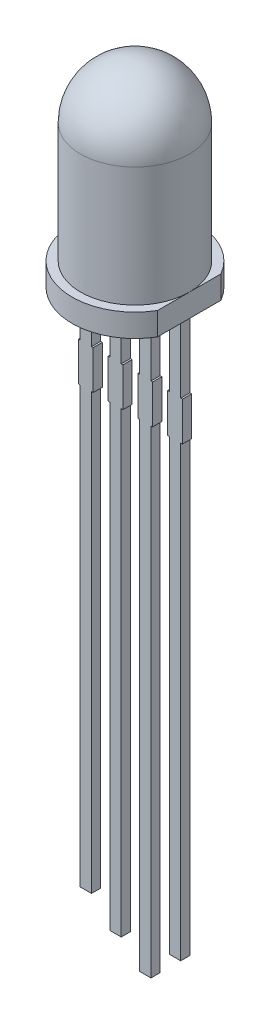
from build123d import *

# Parameters (mm, degrees)
BOSS_EXTRUDE1_START         = -4
BOSS_EXTRUDE1_OUTLINE_W     = 0.5
BOSS_EXTRUDE1_OUTLINE_H     = 0.4
BOSS_EXTRUDE1_OUTLINE_W_2   = 1.8
BOSS_EXTRUDE1_DEPTH         = 25.3
BOSS_EXTRUDE1_2_OUTLINE_W   = 0.5
BOSS_EXTRUDE1_2_OUTLINE_H   = 0.4
BOSS_EXTRUDE1_2_OUTLINE_W_2 = 1.8
BOSS_EXTRUDE1_2_DEPTH       = 1
BOSS_EXTRUDE1_3_OUTLINE_W   = 0.075
BOSS_EXTRUDE1_3_OUTLINE_H   = 0.4
BOSS_EXTRUDE1_3_DEPTH       = 21.3
BOSS_EXTRUDE1_START_2       = 21.3
BOSS_EXTRUDE1_4_OUTLINE_W   = 0.65
BOSS_EXTRUDE1_4_OUTLINE_H   = 0.4
BOSS_EXTRUDE1_4_OUTLINE_W_2 = 1.875
BOSS_EXTRUDE1_4_DEPTH       = 0.4
BOSS_EXTRUDE1_START_3       = 21.7
BOSS_EXTRUDE1_5_OUTLINE_W   = 0.65
BOSS_EXTRUDE1_5_OUTLINE_H   = 0.4
BOSS_EXTRUDE1_5_DEPTH       = 0.9
SKETCH2_W                   = 1.225
SKETCH2_H                   = 21.7
CUT_EXTRUDE1_DEPTH          = 26.915728815
SKETCH6_W                   = 0.4
SKETCH6_H                   = 3
CUT_EXTRUDE2_DEPTH          = 0.8
SKETCH11_W                  = 0.65
SKETCH11_H                  = 0.4
BOSS_EXTRUDE2_DEPTH         = 20.7
SKETCH17_W                  = 0.075
SKETCH17_H                  = 20
CUT_EXTRUDE3_DEPTH          = 0.4
SKETCH18_W                  = 0.075
SKETCH18_H                  = 20
CUT_EXTRUDE4_DEPTH          = 26.915728815
SKETCH19_W                  = 0.075
SKETCH19_H                  = 19.6
CUT_EXTRUDE5_DEPTH          = 26.915728815
SKETCH20_W                  = 0.075
SKETCH20_H                  = 19.6
CUT_EXTRUDE6_DEPTH          = 26.915728815
SKETCH21_W                  = 0.075
SKETCH21_H                  = 20.9
CUT_EXTRUDE7_DEPTH          = 0.4
SKETCH22_W                  = 0.075
SKETCH22_H                  = 20.9
CUT_EXTRUDE8_DEPTH          = 26.915728815
SKETCH23_W                  = 0.075
SKETCH23_H                  = 19
CUT_EXTRUDE9_DEPTH          = 26.915728815
SKETCH24_W                  = 0.075
SKETCH24_H                  = 19
CUT_EXTRUDE10_DEPTH         = 26.915728815


with BuildPart() as part:
    # Boss-Extrude1: read off the stored shape, not the designer's step
    # Boss-Extrude1 outline → Boss-Extrude1 (new body)
    with BuildSketch(Plane.XZ.offset(3).offset(BOSS_EXTRUDE1_START)):
        with Locations((0.65, 0)):
            Rectangle(BOSS_EXTRUDE1_OUTLINE_W, BOSS_EXTRUDE1_OUTLINE_H)
        with Locations((-1.3, 0)):
            Rectangle(BOSS_EXTRUDE1_OUTLINE_W_2, BOSS_EXTRUDE1_OUTLINE_H)
        with Locations((1.95, 0)):
            Rectangle(BOSS_EXTRUDE1_OUTLINE_W, BOSS_EXTRUDE1_OUTLINE_H)
    extrude(amount=BOSS_EXTRUDE1_DEPTH)

    # Boss-Extrude1 2 outline → Boss-Extrude1 2 (add)
    with BuildSketch(Plane.XZ.offset(3).offset(BOSS_EXTRUDE1_START)):
        with BuildLine():
            ThreePointArc((2.375, 1.386317063), (-2.75, 0), (2.375, -1.386317063))
            Line((2.375, -1.386317063), (2.375, 1.386317063))
        make_face()
        with Locations((0.65, 0)):
            Rectangle(BOSS_EXTRUDE1_2_OUTLINE_W, BOSS_EXTRUDE1_2_OUTLINE_H, mode=Mode.SUBTRACT)
        with Locations((-1.3, 0)):
            Rectangle(BOSS_EXTRUDE1_2_OUTLINE_W_2, BOSS_EXTRUDE1_2_OUTLINE_H, mode=Mode.SUBTRACT)
        with Locations((1.95, 0)):
            Rectangle(BOSS_EXTRUDE1_2_OUTLINE_W, BOSS_EXTRUDE1_2_OUTLINE_H, mode=Mode.SUBTRACT)
    extrude(amount=BOSS_EXTRUDE1_2_DEPTH)

    # Boss-Extrude1 3 outline → Boss-Extrude1 3 (add)
    with BuildSketch(Plane.XZ.offset(3)):
        with Locations((0.3625, 0)):
            Rectangle(BOSS_EXTRUDE1_3_OUTLINE_W, BOSS_EXTRUDE1_3_OUTLINE_H)
        with Locations((0.9375, 0)):
            Rectangle(BOSS_EXTRUDE1_3_OUTLINE_W, BOSS_EXTRUDE1_3_OUTLINE_H)
        with Locations((-0.3625, 0)):
            Rectangle(BOSS_EXTRUDE1_3_OUTLINE_W, BOSS_EXTRUDE1_3_OUTLINE_H)
        with Locations((1.6625, 0)):
            Rectangle(BOSS_EXTRUDE1_3_OUTLINE_W, BOSS_EXTRUDE1_3_OUTLINE_H)
        with Locations((2.2375, 0)):
            Rectangle(BOSS_EXTRUDE1_3_OUTLINE_W, BOSS_EXTRUDE1_3_OUTLINE_H)
    extrude(amount=BOSS_EXTRUDE1_3_DEPTH)

    # Boss-Extrude1 4 outline → Boss-Extrude1 4 (add)
    with BuildSketch(Plane.XZ.offset(3).offset(BOSS_EXTRUDE1_START_2)):
        with Locations((0.65, 0)):
            Rectangle(BOSS_EXTRUDE1_4_OUTLINE_W, BOSS_EXTRUDE1_4_OUTLINE_H)
        with Locations((-1.2625, 0)):
            Rectangle(BOSS_EXTRUDE1_4_OUTLINE_W_2, BOSS_EXTRUDE1_4_OUTLINE_H)
    extrude(amount=BOSS_EXTRUDE1_4_DEPTH)

    # Boss-Extrude1 5 outline → Boss-Extrude1 5 (add)
    with BuildSketch(Plane.XZ.offset(3).offset(BOSS_EXTRUDE1_START_3)):
        with Locations((0.65, 0)):
            Rectangle(BOSS_EXTRUDE1_5_OUTLINE_W, BOSS_EXTRUDE1_5_OUTLINE_H)
    extrude(amount=BOSS_EXTRUDE1_5_DEPTH)

    # Sketch2 → Cut-Extrude1 (cut, through all)
    with BuildSketch(Plane.XY.offset(0.2)):
        with Locations((-1.5875, -13.85)):
            Rectangle(SKETCH2_W, SKETCH2_H)
    extrude(amount=-CUT_EXTRUDE1_DEPTH, mode=Mode.SUBTRACT)

    # Sketch6 → Cut-Extrude2 (cut)
    with BuildSketch(Plane(origin=(-0.9, 0, 0), x_dir=(0, 0, -1), z_dir=(1, 0, 0))):
        with Locations((0, -1.5)):
            Rectangle(SKETCH6_W, SKETCH6_H)
    extrude(amount=-CUT_EXTRUDE2_DEPTH, mode=Mode.SUBTRACT)

    # Sketch11 → Boss-Extrude2 (add)
    with BuildSketch(Plane(origin=(0, -3, 0), x_dir=(-1, 0, 0), z_dir=(0, -1, 0))):
        with Locations((1.95, 0)):
            Rectangle(SKETCH11_W, SKETCH11_H)
    extrude(amount=BOSS_EXTRUDE2_DEPTH)

    # Sketch17 → Cut-Extrude3 (cut)
    with BuildSketch(Plane.XY.offset(0.2)):
        with Locations((-0.3625, -14.7)):
            Rectangle(SKETCH17_W, SKETCH17_H)
    extrude(amount=-CUT_EXTRUDE3_DEPTH, mode=Mode.SUBTRACT)

    # Sketch18 → Cut-Extrude4 (cut, through all)
    with BuildSketch(Plane.XY.offset(0.2)):
        with Locations((-0.9375, -14.7)):
            Rectangle(SKETCH18_W, SKETCH18_H)
    extrude(amount=-CUT_EXTRUDE4_DEPTH, mode=Mode.SUBTRACT)

    # Sketch19 → Cut-Extrude5 (cut, through all)
    with BuildSketch(Plane.XY.offset(0.2)):
        with Locations((2.2375, -14.5)):
            Rectangle(SKETCH19_W, SKETCH19_H)
    extrude(amount=-CUT_EXTRUDE5_DEPTH, mode=Mode.SUBTRACT)

    # Sketch20 → Cut-Extrude6 (cut, through all)
    with BuildSketch(Plane.XY.offset(0.2)):
        with Locations((1.6625, -14.5)):
            Rectangle(SKETCH20_W, SKETCH20_H)
    extrude(amount=-CUT_EXTRUDE6_DEPTH, mode=Mode.SUBTRACT)

    # Sketch21 → Cut-Extrude7 (cut)
    with BuildSketch(Plane.XY.offset(0.2)):
        with Locations((0.9375, -15.15)):
            Rectangle(SKETCH21_W, SKETCH21_H)
    extrude(amount=-CUT_EXTRUDE7_DEPTH, mode=Mode.SUBTRACT)

    # Sketch22 → Cut-Extrude8 (cut, through all)
    with BuildSketch(Plane.XY.offset(0.2)):
        with Locations((0.3625, -15.15)):
            Rectangle(SKETCH22_W, SKETCH22_H)
    extrude(amount=-CUT_EXTRUDE8_DEPTH, mode=Mode.SUBTRACT)

    # Sketch23 → Cut-Extrude9 (cut, through all)
    with BuildSketch(Plane.XY.offset(0.2)):
        with Locations((-1.6625, -14.2)):
            Rectangle(SKETCH23_W, SKETCH23_H)
    extrude(amount=-CUT_EXTRUDE9_DEPTH, mode=Mode.SUBTRACT)

    # Sketch24 → Cut-Extrude10 (cut, through all)
    with BuildSketch(Plane.XY.offset(0.2)):
        with Locations((-2.2375, -14.2)):
            Rectangle(SKETCH24_W, SKETCH24_H)
    extrude(amount=-CUT_EXTRUDE10_DEPTH, mode=Mode.SUBTRACT)

    # Boss-Extrude3: read off the stored shape, not the designer's step
    # Boss-Extrude3 outline → Boss-Extrude3 (revolve)
    with BuildSketch(Plane.XY):
        with BuildLine():
            Line((2.375, 1), (2.375, 6.224999998))
            ThreePointArc((2.375, 6.224999998), (1.679378606, 7.904378604), (0, 8.6))
            Line((0, 8.6), (0, 1))
            Line((0, 1), (2.375, 1))
        make_face()
    revolve(axis=Axis((0, 0, 0), (0, 1, 0)))


solid = part.part
